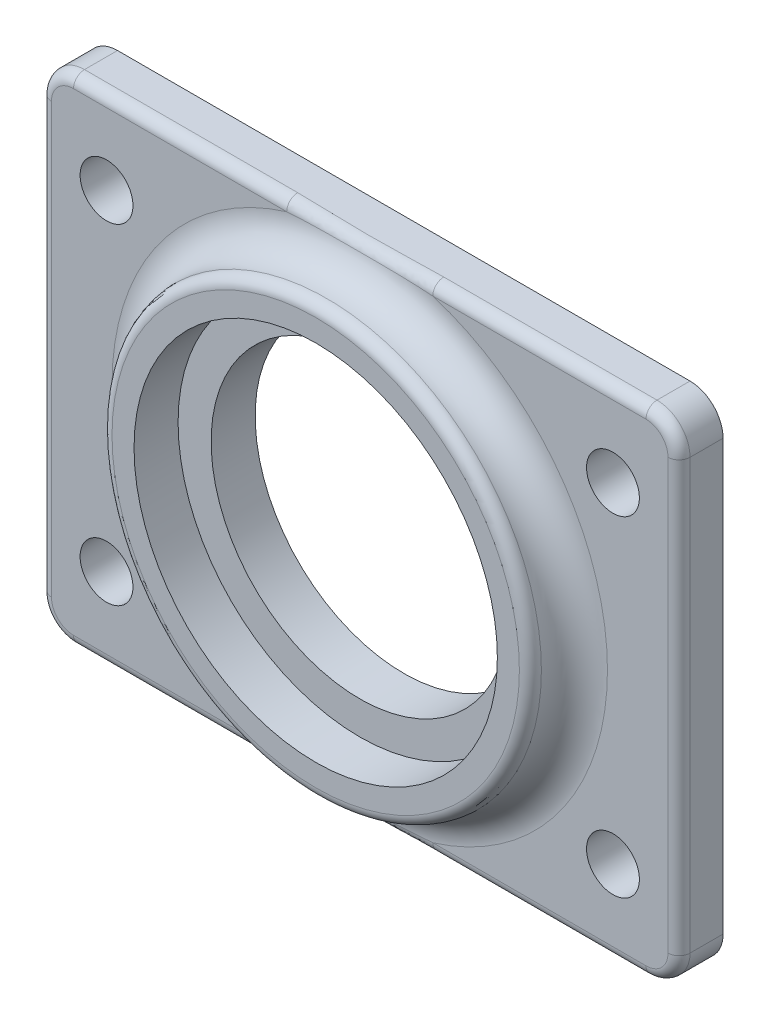
from build123d import *

# Parameters (mm, degrees)
SKETCH1_W            = 58
SKETCH1_H            = 45
SKETCH1_R            = 2
BOSS_EXTRUDE1_DEPTH  = 4
SKETCH4_R            = 19.5
SKETCH4_R_2          = 16.5
BOSS_EXTRUDE3_DEPTH  = 4
SKETCH5_R            = 13.5
CUT_EXTRUDE2_DEPTH   = 37.922215535
M4_CLEARANCE_HOLE1_D = 4.8
FILLET1_R            = 3
FILLET2_R            = 1


with BuildPart() as part:
    # Sketch1 → Boss-Extrude1 (new body)
    # profile 1 of 5: a face of its own
    with BuildSketch(Plane.XY):
        Rectangle(SKETCH1_W, SKETCH1_H)
        with Locations((23, 15)):
            Circle(SKETCH1_R, mode=Mode.SUBTRACT)
        with Locations((23, -15)):
            Circle(SKETCH1_R, mode=Mode.SUBTRACT)
        with Locations((-23, -15)):
            Circle(SKETCH1_R, mode=Mode.SUBTRACT)
        with Locations((-23, 15)):
            Circle(SKETCH1_R, mode=Mode.SUBTRACT)
    # profile 2 of 5: a face of its own
    with BuildSketch(Plane.XY):
        with Locations((-23, 15)):
            Circle(SKETCH1_R)
    # profile 3 of 5: a face of its own
    with BuildSketch(Plane.XY):
        with Locations((-23, -15)):
            Circle(SKETCH1_R)
    # profile 4 of 5: a face of its own
    with BuildSketch(Plane.XY):
        with Locations((23, -15)):
            Circle(SKETCH1_R)
    # profile 5 of 5: a face of its own
    with BuildSketch(Plane.XY):
        with Locations((23, 15)):
            Circle(SKETCH1_R)
    extrude(amount=BOSS_EXTRUDE1_DEPTH)

    # Sketch4 → Boss-Extrude3 (add)
    with BuildSketch(Plane.XY.offset(4)):
        Circle(SKETCH4_R)
        Circle(SKETCH4_R_2, mode=Mode.SUBTRACT)
    extrude(amount=BOSS_EXTRUDE3_DEPTH)

    # Sketch5 → Cut-Extrude2 (cut, through all)
    with BuildSketch(Plane.XY.offset(4)):
        Circle(SKETCH5_R)
    extrude(amount=-CUT_EXTRUDE2_DEPTH, mode=Mode.SUBTRACT)

    # M4 Clearance Hole1 (through all)
    with Locations(Plane.XY.offset(4)):
        with Locations((23, 15), (23, -15), (-23, -15), (-23, 15)):
            Hole(M4_CLEARANCE_HOLE1_D / 2)

    # Fillet1
    fillet1_edges = [part.edges().sort_by_distance(p)[0] for p in [
        (-19.5, 0, 4),
        (29, -22.5, 2),
        (-29, -22.5, 2),
        (-29, 22.5, 2),
        (29, 22.5, 2),
    ]]
    fillet(fillet1_edges, radius=FILLET1_R - 0.0001)  # a hair under: the kernel refuses the full size

    # Fillet2
    fillet2_edges = [part.edges().sort_by_distance(p)[0] for p in [
        (-19.5, 0, 8),
        (0, -22.5, 4),
        (0, -22.5, 4),
        (-29, 0, 4),
        (29, 0, 4),
        (0, 22.5, 4),
        (0, 22.5, 4),
        (28.121349633, 21.621349633, 4),
        (28.121349633, -21.621349633, 4),
        (-28.121349633, 21.621349633, 4),
        (-28.121349633, -21.621349633, 4),
    ]]
    fillet(fillet2_edges, radius=FILLET2_R)


solid = part.part
